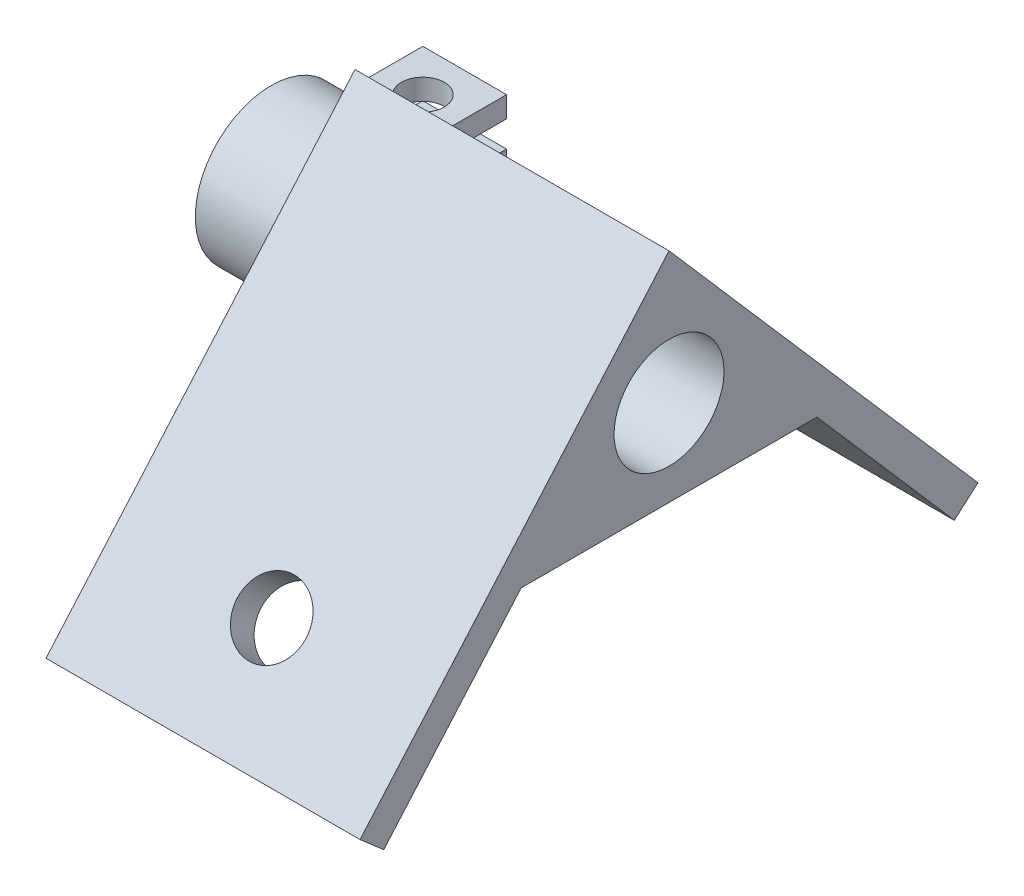
from build123d import *

# Parameters (mm, degrees)
SKETCH1_R            = 5.25
BOSS_EXTRUDE1_DEPTH  = 15
M6_CLEARANCE_HOLE1_D = 6.6
BOSS_EXTRUDE2_START  = 8
BOSS_EXTRUDE2_DEPTH  = 8
SKETCH6_R            = 2.05
CUT_EXTRUDE1_DEPTH   = 46.905147279


with BuildPart() as part:
    # Sketch1 → Boss-Extrude1 (new, symmetric)
    with BuildSketch(Plane(origin=(0, 0, 0), x_dir=(0, 0, -1), z_dir=(1, 0, 0))):
        Polygon((0, 12.575087965), (-29.513243123, -21.376014517), (-27.249114382, -23.344191604), (-14.127933802, -8.25), (14.127933802, -8.25), (27.249114382, -23.344191604), (29.513243123, -21.376014517), align=None)
        Circle(SKETCH1_R, mode=Mode.SUBTRACT)
    extrude(amount=BOSS_EXTRUDE1_DEPTH, both=True)

    # M6 Clearance Hole1 (through all)
    with Locations(Plane(origin=(0, 3.444309902, 3.962225296), x_dir=(-1, 0, 0), z_dir=(0, -0.6560590289905083, -0.7547095802227711))):
        with Locations((0, -25.495112569)):
            m6_clearance_hole1 = Hole(M6_CLEARANCE_HOLE1_D / 2)

    # Mirror1: M6 Clearance Hole1 across plane
    add(m6_clearance_hole1.mirror(Plane.XY), mode=Mode.SUBTRACT)

    # Sketch5 → Boss-Extrude2 (add)
    with BuildSketch(Plane.ZY.offset(15).offset(BOSS_EXTRUDE2_START)):
        with BuildLine():
            Line((-5.099019514, 1.25), (-14.480740698, 1.25))
            Line((-14.480740698, 1.25), (-14.480740698, 3.25))
            Line((-14.480740698, 3.25), (-6.480740698, 3.25))
            ThreePointArc((-6.480740698, 3.25), (7.25, 0), (-6.480740698, -3.25))
            Line((-6.480740698, -3.25), (-6.480740698, -10.25))
            Line((-6.480740698, -10.25), (-14.480740698, -10.25))
            Line((-14.480740698, -10.25), (-14.480740698, -1.25))
            Line((-14.480740698, -1.25), (-5.099019514, -1.25))
            ThreePointArc((-5.099019514, -1.25), (5.25, 0), (-5.099019514, 1.25))
        make_face()
    extrude(amount=-BOSS_EXTRUDE2_DEPTH)

    # Sketch6 → Cut-Extrude1 (cut, through all)
    with BuildSketch(Plane(origin=(0, 3.25, 0), x_dir=(1, 0, 0), z_dir=(0, 1, 0))):
        with Locations((-19, 10.480740698)):
            Circle(SKETCH6_R)
    extrude(amount=-CUT_EXTRUDE1_DEPTH, mode=Mode.SUBTRACT)


solid = part.part
